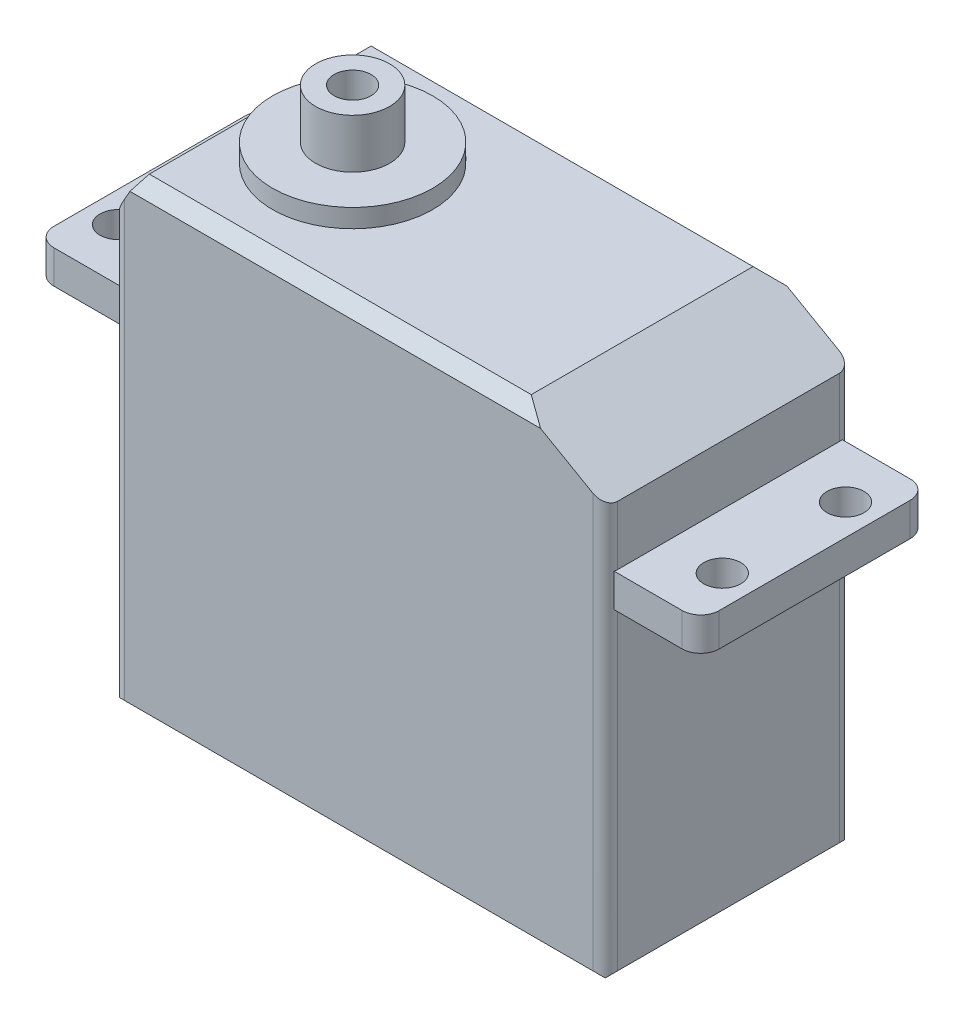
from build123d import *

# Parameters (mm, degrees)
SKETCH_1_W          = 40
SKETCH_1_H          = 38
EXTRUDE_1_DEPTH     = 20
SKETCH_2_W          = 18.5
SKETCH_2_H          = 2.7
EXTRUDE_2_DEPTH     = 7
SKETCH_3_W          = 18.5
SKETCH_3_H          = 2.7
EXTRUDE_3_DEPTH     = 7
SKETCH_4_R          = 1.5
CUT_EXTRUDE_1_DEPTH = 7
CHAMFER_1_SIZE      = 1
CHAMFER_2_SIZE      = 2
CHAMFER_2_SIZE2     = 3.5
CHAMFER_3_SIZE      = 4
CHAMFER_3_SIZE2     = 7
CHAMFER_4_SIZE      = 1
SKETCH_5_R          = 6.5
EXTRUDE_4_DEPTH     = 1.5
SKETCH_6_R          = 3
SKETCH_6_R_2        = 1.5
EXTRUDE_5_DEPTH     = 4
FILLET_1_R          = 1.5
FILLET_2_R          = 1


with BuildPart() as part:
    # 草图1 → 凸台-拉伸1 (new body)
    with BuildSketch(Plane.XY):
        with Locations((20, 19)):
            Rectangle(SKETCH_1_W, SKETCH_1_H)
    extrude(amount=EXTRUDE_1_DEPTH)

    # 草图2 → 凸台-拉伸2 (add)
    with BuildSketch(Plane.ZY):
        with Locations((10, 27.85)):
            Rectangle(SKETCH_2_W, SKETCH_2_H)
    extrude(amount=EXTRUDE_2_DEPTH)

    # 草图3 → 凸台-拉伸3 (add)
    with BuildSketch(Plane(origin=(40, 0, 0), x_dir=(0, 0, -1), z_dir=(1, 0, 0))):
        with Locations((-10, 27.85)):
            Rectangle(SKETCH_3_W, SKETCH_3_H)
    extrude(amount=EXTRUDE_3_DEPTH)

    # 草图4 → 切除-拉伸1 (cut)
    with BuildSketch(Plane(origin=(0, 29.2, 0), x_dir=(1, 0, 0), z_dir=(0, 1, 0))):
        with Locations(Location((-4.5, -5, 0), (0, 0, 270))):
            Circle(SKETCH_4_R)
        with Locations(Location((44.5, -5, 0), (0, 0, 270))):
            Circle(SKETCH_4_R)
        with Locations(Location((-4.5, -15, 0), (0, 0, 270))):
            Circle(SKETCH_4_R)
        with Locations(Location((44.5, -15, 0), (0, 0, 270))):
            Circle(SKETCH_4_R)
    extrude(amount=-CUT_EXTRUDE_1_DEPTH, mode=Mode.SUBTRACT)

    # 倒角1
    chamfer_1_edges = [part.edges().sort_by_distance(p)[0] for p in [
        (20, 0, 0),
        (40, 0, 10),
        (0, 0, 10),
        (20, 0, 20),
    ]]
    chamfer(chamfer_1_edges, length=CHAMFER_1_SIZE)

    # 倒角2
    chamfer_2_edges = [part.edges().sort_by_distance(p)[0] for p in [
        (0, 38, 10),
    ]]
    chamfer_2_side = [part.faces().sort_by_distance(p)[0] for p in [
        (20, 38, 10),
    ]]
    chamfer(chamfer_2_edges, length=CHAMFER_2_SIZE, length2=CHAMFER_2_SIZE2, reference=chamfer_2_side[0])

    # 倒角3
    chamfer_3_edges = [part.edges().sort_by_distance(p)[0] for p in [
        (40, 38, 10),
    ]]
    chamfer_3_side = [part.faces().sort_by_distance(p)[0] for p in [
        (40, 18.895576408, 10),
    ]]
    chamfer(chamfer_3_edges, length=CHAMFER_3_SIZE, length2=CHAMFER_3_SIZE2, reference=chamfer_3_side[0])

    # 倒角4
    chamfer_4_edges = [part.edges().sort_by_distance(p)[0] for p in [
        (17.5, 38, 0),
        (17.5, 38, 20),
    ]]
    chamfer(chamfer_4_edges, length=CHAMFER_4_SIZE)

    # 草图5 → 凸台-拉伸4 (add)
    with BuildSketch(Plane(origin=(0, 38, 0), x_dir=(1, 0, 0), z_dir=(0, 1, 0))):
        with Locations(Location((9.5, -10, 0), (0, 0, 90))):
            Circle(SKETCH_5_R)
    extrude(amount=EXTRUDE_4_DEPTH)

    # 草图6 → 凸台-拉伸5 (add)
    with BuildSketch(Plane(origin=(0, 39.5, 0), x_dir=(1, 0, 0), z_dir=(0, 1, 0))):
        with Locations(Location((9.5, -10, 0), (0, 0, 270))):
            Circle(SKETCH_6_R)
        with Locations(Location((9.5, -10, 0), (0, 0, 270))):
            Circle(SKETCH_6_R_2, mode=Mode.SUBTRACT)
    extrude(amount=EXTRUDE_5_DEPTH)

    # 圆角1
    fillet_1_edges = [part.edges().sort_by_distance(p)[0] for p in [
        (-7, 27.85, 0.75),
        (-7, 27.85, 19.25),
        (47, 27.85, 19.25),
        (47, 27.85, 0.75),
    ]]
    fillet(fillet_1_edges, radius=FILLET_1_R)

    # 圆角2
    # the kernel refuses this fillet: 1 mm, written as the material it takes off along each edge
    with BuildSketch(Plane(origin=(0, 37, 20), x_dir=(1, 0, 0), z_dir=(0, -1, 0))) as fillet_2_piece_1_section:
        with BuildLine():
            CenterArc((FILLET_2_R, -FILLET_2_R), FILLET_2_R, 90, 90)
            Line((0, -FILLET_2_R), (0, 0))
            Line((0, 0), (FILLET_2_R, 0))
        make_face()
    fillet_2_piece_1 = extrude(amount=38.5, mode=Mode.PRIVATE)
    fillet_2_piece_1 = split(fillet_2_piece_1, bisect_by=Plane(origin=(0.233478453, 29.2, 19.792941909), z_dir=(0, 1, 0)), keep=Keep.TOP, mode=Mode.PRIVATE)
    fillet_2_piece_1 = split(fillet_2_piece_1, bisect_by=Plane(origin=(0.233478453, 33.1, 19.25), z_dir=(0, 0, 1)), keep=Keep.TOP, mode=Mode.PRIVATE)
    add(fillet_2_piece_1, mode=Mode.SUBTRACT)
    with BuildSketch(Plane(origin=(0, 37, 20), x_dir=(1, 0, 0), z_dir=(0, -1, 0))) as fillet_2_piece_2_section:
        with BuildLine():
            CenterArc((FILLET_2_R, -FILLET_2_R), FILLET_2_R, 90, 90)
            Line((0, -FILLET_2_R), (0, 0))
            Line((0, 0), (FILLET_2_R, 0))
        make_face()
    fillet_2_piece_2 = extrude(amount=38.5, mode=Mode.PRIVATE)
    fillet_2_piece_2 = split(fillet_2_piece_2, bisect_by=Plane(origin=(-0.003280029, 29.2, 19.146607635), z_dir=(0, 1, 0)), keep=Keep.TOP, mode=Mode.PRIVATE)
    fillet_2_piece_2 = split(fillet_2_piece_2, bisect_by=Plane(origin=(-0.003280029, 33.1, 19.25), z_dir=(0, 0, -1)), keep=Keep.TOP, mode=Mode.PRIVATE)
    add(fillet_2_piece_2, mode=Mode.SUBTRACT)
    with BuildSketch(Plane(origin=(0, 37, 20), x_dir=(1, 0, 0), z_dir=(0, -1, 0))) as fillet_2_piece_3_section:
        with BuildLine():
            CenterArc((FILLET_2_R, -FILLET_2_R), FILLET_2_R, 90, 90)
            Line((0, -FILLET_2_R), (0, 0))
            Line((0, 0), (FILLET_2_R, 0))
        make_face()
    fillet_2_piece_3 = extrude(amount=38.5, mode=Mode.PRIVATE)
    fillet_2_piece_3 = split(fillet_2_piece_3, bisect_by=Plane(origin=(0.233478453, 29.2, 19.792941909), z_dir=(0, -1, 0)), keep=Keep.TOP, mode=Mode.PRIVATE)
    fillet_2_piece_3 = split(fillet_2_piece_3, bisect_by=Plane(origin=(0.233478453, 27.85, 19.25), z_dir=(0, 0, 1)), keep=Keep.TOP, mode=Mode.PRIVATE)
    fillet_2_piece_3 = split(fillet_2_piece_3, bisect_by=Plane(origin=(0.233478453, 26.5, 19.792941909), z_dir=(0, 1, 0)), keep=Keep.TOP, mode=Mode.PRIVATE)
    add(fillet_2_piece_3, mode=Mode.SUBTRACT)
    with BuildSketch(Plane(origin=(0, 37, 20), x_dir=(1, 0, 0), z_dir=(0, -1, 0))) as fillet_2_piece_4_section:
        with BuildLine():
            CenterArc((FILLET_2_R, -FILLET_2_R), FILLET_2_R, 90, 90)
            Line((0, -FILLET_2_R), (0, 0))
            Line((0, 0), (FILLET_2_R, 0))
        make_face()
    fillet_2_piece_4 = extrude(amount=38.5, mode=Mode.PRIVATE)
    fillet_2_piece_4 = split(fillet_2_piece_4, bisect_by=Plane(origin=(0.233478453, 12.5, 19.25), z_dir=(0, 0, 1)), keep=Keep.TOP, mode=Mode.PRIVATE)
    fillet_2_piece_4 = split(fillet_2_piece_4, bisect_by=Plane(origin=(0.233478453, 26.5, 19.792941909), z_dir=(0, -1, 0)), keep=Keep.TOP, mode=Mode.PRIVATE)
    add(fillet_2_piece_4, mode=Mode.SUBTRACT)
    with BuildSketch(Plane(origin=(0, 37, 20), x_dir=(1, 0, 0), z_dir=(0, -1, 0))) as fillet_2_piece_5_section:
        with BuildLine():
            CenterArc((FILLET_2_R, -FILLET_2_R), FILLET_2_R, 90, 90)
            Line((0, -FILLET_2_R), (0, 0))
            Line((0, 0), (FILLET_2_R, 0))
        make_face()
    fillet_2_piece_5 = extrude(amount=38.5, mode=Mode.PRIVATE)
    fillet_2_piece_5 = split(fillet_2_piece_5, bisect_by=Plane(origin=(-0.003280029, 12.5, 19.25), z_dir=(0, 0, -1)), keep=Keep.TOP, mode=Mode.PRIVATE)
    fillet_2_piece_5 = split(fillet_2_piece_5, bisect_by=Plane(origin=(-0.003280029, 26.5, 19.146607635), z_dir=(0, -1, 0)), keep=Keep.TOP, mode=Mode.PRIVATE)
    add(fillet_2_piece_5, mode=Mode.SUBTRACT)
    with BuildSketch(Plane(origin=(0, 37, 0), x_dir=(1, 0, 0), z_dir=(0, -1, 0))) as fillet_2_piece_6_section:
        with BuildLine():
            CenterArc((FILLET_2_R, FILLET_2_R), FILLET_2_R, 180, 90)
            Line((0, FILLET_2_R), (0, 0))
            Line((0, 0), (FILLET_2_R, 0))
        make_face()
    fillet_2_piece_6 = extrude(amount=38.5, mode=Mode.PRIVATE)
    fillet_2_piece_6 = split(fillet_2_piece_6, bisect_by=Plane(origin=(0.233478453, 29.2, 0.207058091), z_dir=(0, 1, 0)), keep=Keep.TOP, mode=Mode.PRIVATE)
    fillet_2_piece_6 = split(fillet_2_piece_6, bisect_by=Plane(origin=(0.233478453, 33.1, 0.75), z_dir=(0, 0, -1)), keep=Keep.TOP, mode=Mode.PRIVATE)
    add(fillet_2_piece_6, mode=Mode.SUBTRACT)
    with BuildSketch(Plane(origin=(0, 37, 0), x_dir=(1, 0, 0), z_dir=(0, -1, 0))) as fillet_2_piece_7_section:
        with BuildLine():
            CenterArc((FILLET_2_R, FILLET_2_R), FILLET_2_R, 180, 90)
            Line((0, FILLET_2_R), (0, 0))
            Line((0, 0), (FILLET_2_R, 0))
        make_face()
    fillet_2_piece_7 = extrude(amount=38.5, mode=Mode.PRIVATE)
    fillet_2_piece_7 = split(fillet_2_piece_7, bisect_by=Plane(origin=(-0.003280029, 29.2, 0.853392365), z_dir=(0, 1, 0)), keep=Keep.TOP, mode=Mode.PRIVATE)
    fillet_2_piece_7 = split(fillet_2_piece_7, bisect_by=Plane(origin=(-0.003280029, 33.1, 0.75), z_dir=(0, 0, 1)), keep=Keep.TOP, mode=Mode.PRIVATE)
    add(fillet_2_piece_7, mode=Mode.SUBTRACT)
    with BuildSketch(Plane(origin=(0, 37, 0), x_dir=(1, 0, 0), z_dir=(0, -1, 0))) as fillet_2_piece_8_section:
        with BuildLine():
            CenterArc((FILLET_2_R, FILLET_2_R), FILLET_2_R, 180, 90)
            Line((0, FILLET_2_R), (0, 0))
            Line((0, 0), (FILLET_2_R, 0))
        make_face()
    fillet_2_piece_8 = extrude(amount=38.5, mode=Mode.PRIVATE)
    fillet_2_piece_8 = split(fillet_2_piece_8, bisect_by=Plane(origin=(0.233478453, 29.2, 0.207058091), z_dir=(0, -1, 0)), keep=Keep.TOP, mode=Mode.PRIVATE)
    fillet_2_piece_8 = split(fillet_2_piece_8, bisect_by=Plane(origin=(0.233478453, 26.5, 0.207058091), z_dir=(0, 1, 0)), keep=Keep.TOP, mode=Mode.PRIVATE)
    fillet_2_piece_8 = split(fillet_2_piece_8, bisect_by=Plane(origin=(0.233478453, 27.85, 0.75), z_dir=(0, 0, -1)), keep=Keep.TOP, mode=Mode.PRIVATE)
    add(fillet_2_piece_8, mode=Mode.SUBTRACT)
    with BuildSketch(Plane(origin=(0, 37, 0), x_dir=(1, 0, 0), z_dir=(0, -1, 0))) as fillet_2_piece_9_section:
        with BuildLine():
            CenterArc((FILLET_2_R, FILLET_2_R), FILLET_2_R, 180, 90)
            Line((0, FILLET_2_R), (0, 0))
            Line((0, 0), (FILLET_2_R, 0))
        make_face()
    fillet_2_piece_9 = extrude(amount=38.5, mode=Mode.PRIVATE)
    fillet_2_piece_9 = split(fillet_2_piece_9, bisect_by=Plane(origin=(0.233478453, 26.5, 0.207058091), z_dir=(0, -1, 0)), keep=Keep.TOP, mode=Mode.PRIVATE)
    fillet_2_piece_9 = split(fillet_2_piece_9, bisect_by=Plane(origin=(0.233478453, 12.5, 0.75), z_dir=(0, 0, -1)), keep=Keep.TOP, mode=Mode.PRIVATE)
    add(fillet_2_piece_9, mode=Mode.SUBTRACT)
    with BuildSketch(Plane(origin=(0, 37, 0), x_dir=(1, 0, 0), z_dir=(0, -1, 0))) as fillet_2_piece_10_section:
        with BuildLine():
            CenterArc((FILLET_2_R, FILLET_2_R), FILLET_2_R, 180, 90)
            Line((0, FILLET_2_R), (0, 0))
            Line((0, 0), (FILLET_2_R, 0))
        make_face()
    fillet_2_piece_10 = extrude(amount=38.5, mode=Mode.PRIVATE)
    fillet_2_piece_10 = split(fillet_2_piece_10, bisect_by=Plane(origin=(-0.003280029, 26.5, 0.853392365), z_dir=(0, -1, 0)), keep=Keep.TOP, mode=Mode.PRIVATE)
    fillet_2_piece_10 = split(fillet_2_piece_10, bisect_by=Plane(origin=(-0.003280029, 12.5, 0.75), z_dir=(0, 0, 1)), keep=Keep.TOP, mode=Mode.PRIVATE)
    add(fillet_2_piece_10, mode=Mode.SUBTRACT)
    with BuildSketch(Plane(origin=(40, -1.5, 0), x_dir=(0, 0, 1), z_dir=(0, 1, 0))) as fillet_2_piece_11_section:
        with BuildLine():
            CenterArc((FILLET_2_R, -FILLET_2_R), FILLET_2_R, 90, 90)
            Line((0, -FILLET_2_R), (0, 0))
            Line((0, 0), (FILLET_2_R, 0))
        make_face()
    fillet_2_piece_11 = extrude(amount=38, mode=Mode.PRIVATE)
    fillet_2_piece_11 = split(fillet_2_piece_11, bisect_by=Plane(origin=(40.003280029, 26.5, 0.853392365), z_dir=(0, -1, 0)), keep=Keep.TOP, mode=Mode.PRIVATE)
    fillet_2_piece_11 = split(fillet_2_piece_11, bisect_by=Plane(origin=(40.003280029, 12.5, 0.75), z_dir=(0, 0, 1)), keep=Keep.TOP, mode=Mode.PRIVATE)
    add(fillet_2_piece_11, mode=Mode.SUBTRACT)
    with BuildSketch(Plane(origin=(40, -1.5, 0), x_dir=(0, 0, 1), z_dir=(0, 1, 0))) as fillet_2_piece_12_section:
        with BuildLine():
            CenterArc((FILLET_2_R, -FILLET_2_R), FILLET_2_R, 90, 90)
            Line((0, -FILLET_2_R), (0, 0))
            Line((0, 0), (FILLET_2_R, 0))
        make_face()
    fillet_2_piece_12 = extrude(amount=38, mode=Mode.PRIVATE)
    fillet_2_piece_12 = split(fillet_2_piece_12, bisect_by=Plane(origin=(39.766521547, 26.5, 0.207058091), z_dir=(0, -1, 0)), keep=Keep.TOP, mode=Mode.PRIVATE)
    fillet_2_piece_12 = split(fillet_2_piece_12, bisect_by=Plane(origin=(39.766521547, 12.5, 0.75), z_dir=(0, 0, -1)), keep=Keep.TOP, mode=Mode.PRIVATE)
    add(fillet_2_piece_12, mode=Mode.SUBTRACT)
    with BuildSketch(Plane(origin=(40, -1.5, 0), x_dir=(0, 0, 1), z_dir=(0, 1, 0))) as fillet_2_piece_13_section:
        with BuildLine():
            CenterArc((FILLET_2_R, -FILLET_2_R), FILLET_2_R, 90, 90)
            Line((0, -FILLET_2_R), (0, 0))
            Line((0, 0), (FILLET_2_R, 0))
        make_face()
    fillet_2_piece_13 = extrude(amount=38, mode=Mode.PRIVATE)
    fillet_2_piece_13 = split(fillet_2_piece_13, bisect_by=Plane(origin=(39.766521547, 26.5, 0.207058091), z_dir=(0, 1, 0)), keep=Keep.TOP, mode=Mode.PRIVATE)
    fillet_2_piece_13 = split(fillet_2_piece_13, bisect_by=Plane(origin=(39.766521547, 29.2, 0.207058091), z_dir=(0, -1, 0)), keep=Keep.TOP, mode=Mode.PRIVATE)
    fillet_2_piece_13 = split(fillet_2_piece_13, bisect_by=Plane(origin=(39.766521547, 27.85, 0.75), z_dir=(0, 0, -1)), keep=Keep.TOP, mode=Mode.PRIVATE)
    add(fillet_2_piece_13, mode=Mode.SUBTRACT)
    with BuildSketch(Plane(origin=(40, -1.5, 0), x_dir=(0, 0, 1), z_dir=(0, 1, 0))) as fillet_2_piece_14_section:
        with BuildLine():
            CenterArc((FILLET_2_R, -FILLET_2_R), FILLET_2_R, 90, 90)
            Line((0, -FILLET_2_R), (0, 0))
            Line((0, 0), (FILLET_2_R, 0))
        make_face()
    fillet_2_piece_14 = extrude(amount=38, mode=Mode.PRIVATE)
    fillet_2_piece_14 = split(fillet_2_piece_14, bisect_by=Plane(origin=(40.003280029, 29.2, 0.853392365), z_dir=(0, 1, 0)), keep=Keep.TOP, mode=Mode.PRIVATE)
    fillet_2_piece_14 = split(fillet_2_piece_14, bisect_by=Plane(origin=(40.003280029, 32.85, 0.75), z_dir=(0, 0, 1)), keep=Keep.TOP, mode=Mode.PRIVATE)
    add(fillet_2_piece_14, mode=Mode.SUBTRACT)
    with BuildSketch(Plane(origin=(40, -1.5, 0), x_dir=(0, 0, 1), z_dir=(0, 1, 0))) as fillet_2_piece_15_section:
        with BuildLine():
            CenterArc((FILLET_2_R, -FILLET_2_R), FILLET_2_R, 90, 90)
            Line((0, -FILLET_2_R), (0, 0))
            Line((0, 0), (FILLET_2_R, 0))
        make_face()
    fillet_2_piece_15 = extrude(amount=38, mode=Mode.PRIVATE)
    fillet_2_piece_15 = split(fillet_2_piece_15, bisect_by=Plane(origin=(39.766521547, 29.2, 0.207058091), z_dir=(0, 1, 0)), keep=Keep.TOP, mode=Mode.PRIVATE)
    fillet_2_piece_15 = split(fillet_2_piece_15, bisect_by=Plane(origin=(39.766521547, 32.85, 0.75), z_dir=(0, 0, -1)), keep=Keep.TOP, mode=Mode.PRIVATE)
    add(fillet_2_piece_15, mode=Mode.SUBTRACT)
    with BuildSketch(Plane(origin=(40, -1.5, 20), x_dir=(0, 0, -1), z_dir=(0, 1, 0))) as fillet_2_piece_16_section:
        with BuildLine():
            CenterArc((FILLET_2_R, FILLET_2_R), FILLET_2_R, 180, 90)
            Line((0, FILLET_2_R), (0, 0))
            Line((0, 0), (FILLET_2_R, 0))
        make_face()
    fillet_2_piece_16 = extrude(amount=38, mode=Mode.PRIVATE)
    fillet_2_piece_16 = split(fillet_2_piece_16, bisect_by=Plane(origin=(40.003280029, 26.5, 19.146607635), z_dir=(0, -1, 0)), keep=Keep.TOP, mode=Mode.PRIVATE)
    fillet_2_piece_16 = split(fillet_2_piece_16, bisect_by=Plane(origin=(40.003280029, 12.5, 19.25), z_dir=(0, 0, -1)), keep=Keep.TOP, mode=Mode.PRIVATE)
    add(fillet_2_piece_16, mode=Mode.SUBTRACT)
    with BuildSketch(Plane(origin=(40, -1.5, 20), x_dir=(0, 0, -1), z_dir=(0, 1, 0))) as fillet_2_piece_17_section:
        with BuildLine():
            CenterArc((FILLET_2_R, FILLET_2_R), FILLET_2_R, 180, 90)
            Line((0, FILLET_2_R), (0, 0))
            Line((0, 0), (FILLET_2_R, 0))
        make_face()
    fillet_2_piece_17 = extrude(amount=38, mode=Mode.PRIVATE)
    fillet_2_piece_17 = split(fillet_2_piece_17, bisect_by=Plane(origin=(39.766521547, 26.5, 19.792941909), z_dir=(0, -1, 0)), keep=Keep.TOP, mode=Mode.PRIVATE)
    fillet_2_piece_17 = split(fillet_2_piece_17, bisect_by=Plane(origin=(39.766521547, 12.5, 19.25), z_dir=(0, 0, 1)), keep=Keep.TOP, mode=Mode.PRIVATE)
    add(fillet_2_piece_17, mode=Mode.SUBTRACT)
    with BuildSketch(Plane(origin=(40, -1.5, 20), x_dir=(0, 0, -1), z_dir=(0, 1, 0))) as fillet_2_piece_18_section:
        with BuildLine():
            CenterArc((FILLET_2_R, FILLET_2_R), FILLET_2_R, 180, 90)
            Line((0, FILLET_2_R), (0, 0))
            Line((0, 0), (FILLET_2_R, 0))
        make_face()
    fillet_2_piece_18 = extrude(amount=38, mode=Mode.PRIVATE)
    fillet_2_piece_18 = split(fillet_2_piece_18, bisect_by=Plane(origin=(39.766521547, 26.5, 19.792941909), z_dir=(0, 1, 0)), keep=Keep.TOP, mode=Mode.PRIVATE)
    fillet_2_piece_18 = split(fillet_2_piece_18, bisect_by=Plane(origin=(39.766521547, 27.85, 19.25), z_dir=(0, 0, 1)), keep=Keep.TOP, mode=Mode.PRIVATE)
    fillet_2_piece_18 = split(fillet_2_piece_18, bisect_by=Plane(origin=(39.766521547, 29.2, 19.792941909), z_dir=(0, -1, 0)), keep=Keep.TOP, mode=Mode.PRIVATE)
    add(fillet_2_piece_18, mode=Mode.SUBTRACT)
    with BuildSketch(Plane(origin=(40, -1.5, 20), x_dir=(0, 0, -1), z_dir=(0, 1, 0))) as fillet_2_piece_19_section:
        with BuildLine():
            CenterArc((FILLET_2_R, FILLET_2_R), FILLET_2_R, 180, 90)
            Line((0, FILLET_2_R), (0, 0))
            Line((0, 0), (FILLET_2_R, 0))
        make_face()
    fillet_2_piece_19 = extrude(amount=38, mode=Mode.PRIVATE)
    fillet_2_piece_19 = split(fillet_2_piece_19, bisect_by=Plane(origin=(40.003280029, 32.85, 19.25), z_dir=(0, 0, -1)), keep=Keep.TOP, mode=Mode.PRIVATE)
    fillet_2_piece_19 = split(fillet_2_piece_19, bisect_by=Plane(origin=(40.003280029, 29.2, 19.146607635), z_dir=(0, 1, 0)), keep=Keep.TOP, mode=Mode.PRIVATE)
    add(fillet_2_piece_19, mode=Mode.SUBTRACT)
    with BuildSketch(Plane(origin=(40, -1.5, 20), x_dir=(0, 0, -1), z_dir=(0, 1, 0))) as fillet_2_piece_20_section:
        with BuildLine():
            CenterArc((FILLET_2_R, FILLET_2_R), FILLET_2_R, 180, 90)
            Line((0, FILLET_2_R), (0, 0))
            Line((0, 0), (FILLET_2_R, 0))
        make_face()
    fillet_2_piece_20 = extrude(amount=38, mode=Mode.PRIVATE)
    fillet_2_piece_20 = split(fillet_2_piece_20, bisect_by=Plane(origin=(39.766521547, 32.85, 19.25), z_dir=(0, 0, 1)), keep=Keep.TOP, mode=Mode.PRIVATE)
    fillet_2_piece_20 = split(fillet_2_piece_20, bisect_by=Plane(origin=(39.766521547, 29.2, 19.792941909), z_dir=(0, 1, 0)), keep=Keep.TOP, mode=Mode.PRIVATE)
    add(fillet_2_piece_20, mode=Mode.SUBTRACT)


solid = part.part
